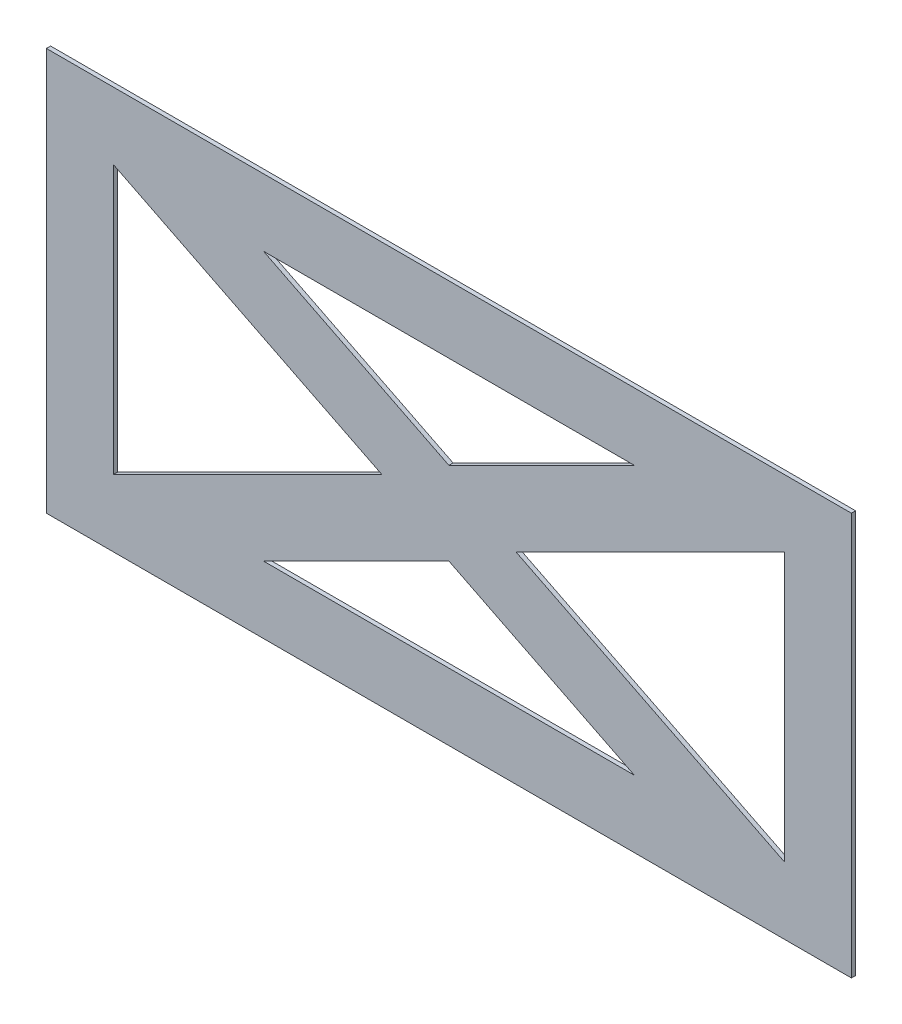
from build123d import *

# Parameters (mm, degrees)
SKETCH1_W           = 304.8
SKETCH1_H           = 152.4
BOSS_EXTRUDE1_DEPTH = 0.79375


with BuildPart() as part:
    # Sketch1 → Boss-Extrude1 (new, symmetric)
    with BuildSketch(Plane.XY):
        Rectangle(SKETCH1_W, SKETCH1_H)
        Polygon((-127, 50.8), (-127, -50.8), (-25.4, 0), align=None, mode=Mode.SUBTRACT)
        Polygon((-70.203873372, 50.8), (70.203873372, 50.8), (0, 15.698063314), align=None, mode=Mode.SUBTRACT)
        Polygon((0, -15.698063314), (-70.203873372, -50.8), (70.203873372, -50.8), align=None, mode=Mode.SUBTRACT)
        Polygon((25.4, 0), (127, 50.8), (127, -50.8), align=None, mode=Mode.SUBTRACT)
    extrude(amount=BOSS_EXTRUDE1_DEPTH, both=True)


solid = part.part
